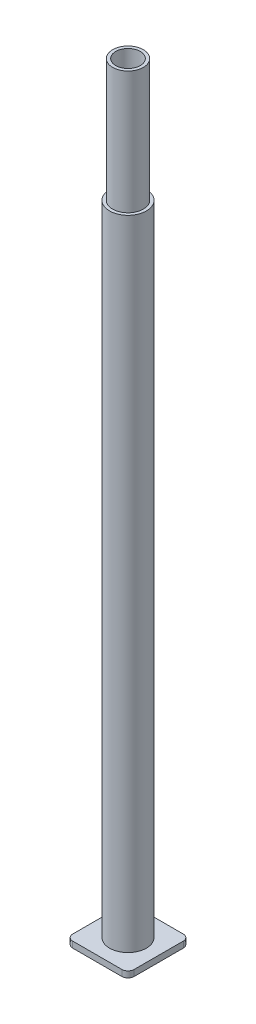
from build123d import *

# Parameters (mm, degrees)
SKETCH_2_W          = 100
SKETCH_2_H          = 100
EXTRUDE_1_DEPTH     = 10
FILLET_1_R          = 10
SHELL_START         = 5
SHELL_1_OUTLINE_R   = 25
SHELL_1_DEPTH       = 1040
SHELL_START_2       = 1045
SHELL_1_2_OUTLINE_R = 20
SHELL_1_2_DEPTH     = 205


# Read off the part's stored shape, not the designer's step: 抽壳1
with BuildPart() as part:
    # 草图1 → 旋转1 (revolve)
    with BuildSketch(Plane.XY, mode=Mode.PRIVATE) as revolve_1_sk:
        Polygon((0, 0), (30, 0), (30, 1050), (25, 1050), (25, 1250), (0, 1250), align=None)
    revolve(revolve_1_sk.sketch.rotate(Axis((0, 1250, 0), (0, -1, 0)), 180), axis=Axis((0, 1250, 0), (0, -1, 0)))

    # 草图2 → 凸台-拉伸1 (add)
    with BuildSketch(Plane.XZ):
        Rectangle(SKETCH_2_W, SKETCH_2_H)
    extrude(amount=-EXTRUDE_1_DEPTH)

    # 圆角1
    fillet_1_edges = [part.edges().sort_by_distance(p)[0] for p in [
        (50, 5, 50),
        (50, 5, -50),
        (-50, 5, -50),
        (-50, 5, 50),
    ]]
    fillet(fillet_1_edges, radius=FILLET_1_R)

    # 抽壳1 outline → 抽壳1 (cut)
    with BuildSketch(Plane(origin=(0, 0, 0), x_dir=(1, 0, 0), z_dir=(0, 1, 0)).offset(SHELL_START)):
        Circle(SHELL_1_OUTLINE_R)
    extrude(amount=SHELL_1_DEPTH, mode=Mode.SUBTRACT)

    # Shell 1 2 outline → Shell 1 2 (cut)
    with BuildSketch(Plane(origin=(0, 0, 0), x_dir=(1, 0, 0), z_dir=(0, 1, 0)).offset(SHELL_START_2)):
        Circle(SHELL_1_2_OUTLINE_R)
    extrude(amount=SHELL_1_2_DEPTH, mode=Mode.SUBTRACT)


solid = part.part
